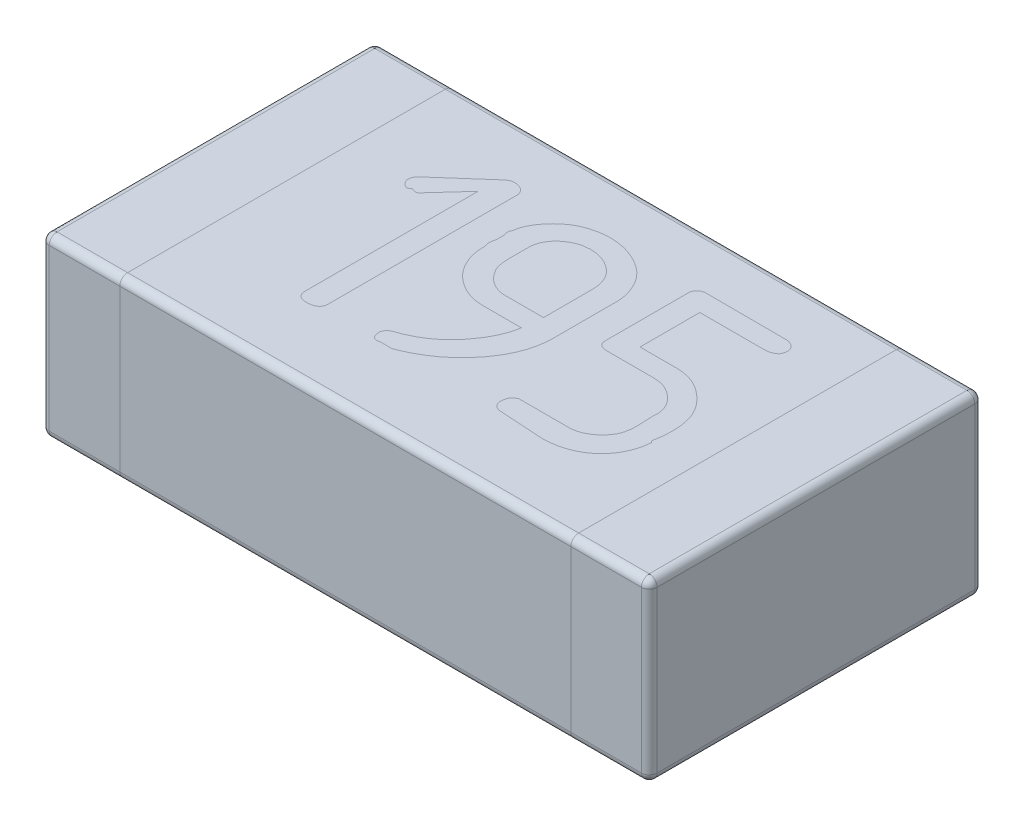
from build123d import *

# Parameters (mm, degrees)
BOSS_EXTRUDE1_DEPTH = 0.225
FILLET2_R           = 0.02


with BuildPart() as part:
    # Sketch1 → Boss-Extrude1 (new, symmetric)
    with BuildSketch(Plane(origin=(0, 0, 0), x_dir=(1, 0, 0), z_dir=(0, 1, 0))):
        with BuildLine():
            Line((-0.755, -0.425), (0.755, -0.425))
            ThreePointArc((0.755, -0.425), (0.769142136, -0.419142136), (0.775, -0.405))
            Line((0.775, -0.405), (0.775, 0.405))
            ThreePointArc((0.775, 0.405), (0.769142136, 0.419142136), (0.755, 0.425))
            Line((0.755, 0.425), (-0.755, 0.425))
            ThreePointArc((-0.755, 0.425), (-0.769142136, 0.419142136), (-0.775, 0.405))
            Line((-0.775, 0.405), (-0.775, -0.405))
            ThreePointArc((-0.775, -0.405), (-0.769142136, -0.419142136), (-0.755, -0.425))
        make_face()
    extrude(amount=BOSS_EXTRUDE1_DEPTH, both=True)

    # Fillet2
    fillet2_edges = [part.edges().sort_by_distance(p)[0] for p in [
        (0, -0.225, 0.425),
        (0, -0.225, 0.425),
        (0, -0.225, 0.425),
        (-0.769142136, -0.225, 0.419142136),
        (-0.775, -0.225, 0),
        (-0.769142136, -0.225, -0.419142136),
        (0, -0.225, -0.425),
        (0, -0.225, -0.425),
        (0, -0.225, -0.425),
        (0.769142136, -0.225, -0.419142136),
        (0.775, -0.225, 0),
        (0.769142136, -0.225, 0.419142136),
        (-0.769142136, 0.225, 0.419142136),
        (-0.775, 0.225, 0),
        (-0.769142136, 0.225, -0.419142136),
        (0, 0.225, -0.425),
        (0, 0.225, -0.425),
        (0, 0.225, -0.425),
        (0.769142136, 0.225, -0.419142136),
        (0.775, 0.225, 0),
        (0.769142136, 0.225, 0.419142136),
        (0, 0.225, 0.425),
        (0, 0.225, 0.425),
        (0, 0.225, 0.425),
    ]]
    fillet(fillet2_edges, radius=FILLET2_R)


solid = part.part
